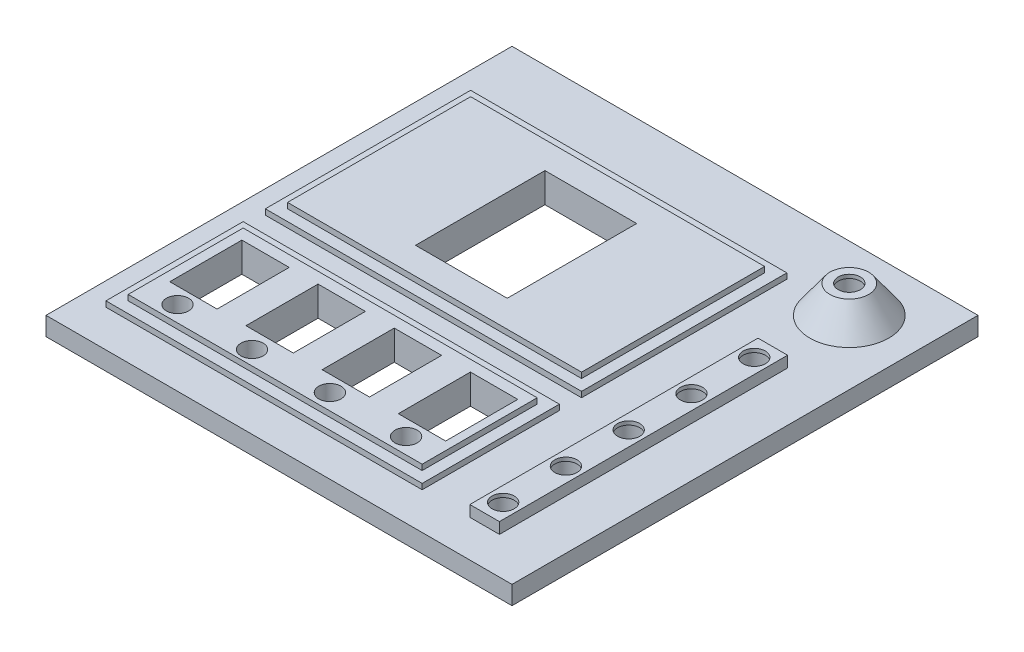
from build123d import *

# Parameters (mm, degrees)
SKETCH1_W           = 126
SKETCH1_H           = 126
BOSS_EXTRUDE1_DEPTH = 5
SKETCH3_R           = 12.5
BOSS_EXTRUDE2_DEPTH = 7.5
SKETCH4_R           = 3.45
CUT_EXTRUDE1_DEPTH  = 11.5
SKETCH6_R           = 3
CUT_EXTRUDE2_DEPTH  = 179.628805068
CHAMFER1_SIZE       = 10
CHAMFER1_SIZE_2     = 7.26542528
SKETCH7_W           = 8
SKETCH7_H           = 77.91635632
BOSS_EXTRUDE3_DEPTH = 3
SKETCH8_R           = 3
CUT_EXTRUDE3_DEPTH  = 179.370401132
SKETCH9_R           = 3.45
CUT_EXTRUDE4_DEPTH  = 7
SKETCH10_W          = 85.5
SKETCH10_H          = 55.5
SKETCH10_H_2        = 37.1
SKETCH10_W_2        = 73.5
SKETCH10_H_3        = 19.1
SKETCH10_W_3        = 36.75
SKETCH10_H_4        = 9.55
BOSS_EXTRUDE5_DEPTH = 1.5
SKETCH12_W          = 79.5
SKETCH12_H          = 49.5
BOSS_EXTRUDE6_DEPTH = 1.5
SKETCH13_W          = 79.5
SKETCH13_H          = 31.1
BOSS_EXTRUDE7_DEPTH = 1.5
SKETCH14_W          = 24.8
SKETCH14_H          = 35
CUT_EXTRUDE5_DEPTH  = 179.370401132
SKETCH15_W          = 12.8
SKETCH15_H          = 19.5
CUT_EXTRUDE6_DEPTH  = 179.370401132
SKETCH16_R          = 3
CUT_EXTRUDE7_DEPTH  = 179.370401132


with BuildPart() as part:
    # Sketch1 → Boss-Extrude1 (new body)
    with BuildSketch(Plane(origin=(0, 0, 0), x_dir=(1, 0, 0), z_dir=(0, 1, 0))):
        with Locations((63, 63)):
            Rectangle(SKETCH1_W, SKETCH1_H)
    extrude(amount=BOSS_EXTRUDE1_DEPTH)

    # Sketch3 → Boss-Extrude2 (add)
    with BuildSketch(Plane(origin=(0, 5, 0), x_dir=(1, 0, 0), z_dir=(0, 1, 0))):
        with Locations(Location((108.6, 108.6, 0), (0, 0, 90))):
            Circle(SKETCH3_R)
    extrude(amount=BOSS_EXTRUDE2_DEPTH)

    # Sketch4 → Cut-Extrude1 (cut)
    with BuildSketch(Plane.XZ):
        with Locations(Location((108.6, -108.6, 0), (0, 0, 270))):
            Circle(SKETCH4_R)
    extrude(amount=-CUT_EXTRUDE1_DEPTH, mode=Mode.SUBTRACT)

    # Sketch6 → Cut-Extrude2 (cut, through all)
    with BuildSketch(Plane(origin=(0, 12.5, 0), x_dir=(1, 0, 0), z_dir=(0, 1, 0))):
        with Locations(Location((108.6, 108.6, 0), (0, 0, 270))):
            Circle(SKETCH6_R)
    extrude(amount=-CUT_EXTRUDE2_DEPTH, mode=Mode.SUBTRACT)

    # Chamfer1
    # the kernel refuses this chamfer: 10, 7.26542528 mm, written as the material it takes off along each edge
    with BuildSketch(Plane(origin=(108.6, 12.5, -108.6), x_dir=(0, 0, -1), z_dir=(1, 0, 0))) as chamfer1_piece_1_section:
        Polygon((12.5, -CHAMFER1_SIZE), (12.5 - CHAMFER1_SIZE_2, 0), (12.5, 0), align=None)
    chamfer1_piece_1 = revolve(axis=Axis((108.6, 12.5, -108.6), (0, 1, 0)), mode=Mode.PRIVATE)
    chamfer1_piece_1 = split(chamfer1_piece_1, bisect_by=Plane(origin=(108.6, 5, -100.650989912), z_dir=(0, 1, 0)), keep=Keep.TOP, mode=Mode.PRIVATE)
    add(chamfer1_piece_1, mode=Mode.SUBTRACT)

    # Sketch7 → Boss-Extrude3 (add)
    with BuildSketch(Plane(origin=(0, 5, 0), x_dir=(1, 0, 0), z_dir=(0, 1, 0))):
        with Locations((108.6, 48.95817816)):
            Rectangle(SKETCH7_W, SKETCH7_H)
    extrude(amount=BOSS_EXTRUDE3_DEPTH)

    # Sketch8 → Cut-Extrude3 (cut, through all)
    with BuildSketch(Plane(origin=(0, 8, 0), x_dir=(1, 0, 0), z_dir=(0, 1, 0))):
        with Locations(Location((108.6, 15, 0), (0, 0, 270))):
            Circle(SKETCH8_R)
        with Locations(Location((108.6, 31.974801407, 0), (0, 0, 270))):
            Circle(SKETCH8_R)
        with Locations(Location((108.6, 48.949602814, 0), (0, 0, 270))):
            Circle(SKETCH8_R)
        with Locations(Location((108.6, 65.924404221, 0), (0, 0, 270))):
            Circle(SKETCH8_R)
        with Locations(Location((108.6, 82.899205628, 0), (0, 0, 270))):
            Circle(SKETCH8_R)
    extrude(amount=-CUT_EXTRUDE3_DEPTH, mode=Mode.SUBTRACT)

    # Sketch9 → Cut-Extrude4 (cut)
    with BuildSketch(Plane.XZ):
        with Locations(Location((108.6, -82.899205628, 0), (0, 0, 270))):
            Circle(SKETCH9_R)
        with Locations(Location((108.6, -65.924404221, 0), (0, 0, 270))):
            Circle(SKETCH9_R)
        with Locations(Location((108.6, -48.949602814, 0), (0, 0, 270))):
            Circle(SKETCH9_R)
        with Locations(Location((108.6, -15, 0), (0, 0, 270))):
            Circle(SKETCH9_R)
        with Locations(Location((108.6, -31.974801407, 0), (0, 0, 270))):
            Circle(SKETCH9_R)
    extrude(amount=-CUT_EXTRUDE4_DEPTH, mode=Mode.SUBTRACT)

    # Sketch10 → Boss-Extrude5 (add)
    # profile 1 of 6: a face of its own
    with BuildSketch(Plane(origin=(0, 5, 0), x_dir=(1, 0, 0), z_dir=(0, 1, 0))):
        with Locations((48.95817816, 80.85)):
            Rectangle(SKETCH10_W, SKETCH10_H)
    # profile 2 of 6: a face of its own
    with BuildSketch(Plane(origin=(0, 5, 0), x_dir=(1, 0, 0), z_dir=(0, 1, 0))):
        with Locations((48.95817816, 28.55)):
            Rectangle(SKETCH10_W, SKETCH10_H_2)
        with Locations((48.95817816, 31.55)):
            Rectangle(SKETCH10_W_2, SKETCH10_H_3, mode=Mode.SUBTRACT)
    # profile 3 of 6: a face of its own
    with BuildSketch(Plane(origin=(0, 5, 0), x_dir=(1, 0, 0), z_dir=(0, 1, 0))):
        with Locations((30.58317816, 26.775)):
            Rectangle(SKETCH10_W_3, SKETCH10_H_4)
    # profile 4 of 6: a face of its own
    with BuildSketch(Plane(origin=(0, 5, 0), x_dir=(1, 0, 0), z_dir=(0, 1, 0))):
        with Locations((30.58317816, 36.325)):
            Rectangle(SKETCH10_W_3, SKETCH10_H_4)
    # profile 5 of 6: a face of its own
    with BuildSketch(Plane(origin=(0, 5, 0), x_dir=(1, 0, 0), z_dir=(0, 1, 0))):
        with Locations((67.33317816, 36.325)):
            Rectangle(SKETCH10_W_3, SKETCH10_H_4)
    # profile 6 of 6: a face of its own
    with BuildSketch(Plane(origin=(0, 5, 0), x_dir=(1, 0, 0), z_dir=(0, 1, 0))):
        with Locations((67.33317816, 26.775)):
            Rectangle(SKETCH10_W_3, SKETCH10_H_4)
    extrude(amount=BOSS_EXTRUDE5_DEPTH)

    # Sketch12 → Boss-Extrude6 (add)
    with BuildSketch(Plane(origin=(0, 6.5, 0), x_dir=(1, 0, 0), z_dir=(0, 1, 0))):
        with Locations((48.95817816, 80.85)):
            Rectangle(SKETCH12_W, SKETCH12_H)
    extrude(amount=BOSS_EXTRUDE6_DEPTH)

    # Sketch13 → Boss-Extrude7 (add)
    with BuildSketch(Plane(origin=(0, 6.5, 0), x_dir=(1, 0, 0), z_dir=(0, 1, 0))):
        with Locations((48.95817816, 28.55)):
            Rectangle(SKETCH13_W, SKETCH13_H)
    extrude(amount=BOSS_EXTRUDE7_DEPTH)

    # Sketch14 → Cut-Extrude5 (cut, through all)
    with BuildSketch(Plane(origin=(0, 8, 0), x_dir=(1, 0, 0), z_dir=(0, 1, 0))):
        with Locations((48.95817816, 80.85)):
            Rectangle(SKETCH14_W, SKETCH14_H)
    extrude(amount=-CUT_EXTRUDE5_DEPTH, mode=Mode.SUBTRACT)

    # Sketch15 → Cut-Extrude6 (cut, through all)
    with BuildSketch(Plane(origin=(0, 8, 0), x_dir=(1, 0, 0), z_dir=(0, 1, 0))):
        with Locations((38.862130436, 31.35)):
            Rectangle(SKETCH15_W, SKETCH15_H)
        with Locations((18.262130436, 31.35)):
            Rectangle(SKETCH15_W, SKETCH15_H)
        with Locations((59.462130436, 31.35)):
            Rectangle(SKETCH15_W, SKETCH15_H)
        with Locations((80.062130436, 31.35)):
            Rectangle(SKETCH15_W, SKETCH15_H)
    extrude(amount=-CUT_EXTRUDE6_DEPTH, mode=Mode.SUBTRACT)

    # Sketch16 → Cut-Extrude7 (cut, through all)
    with BuildSketch(Plane(origin=(0, 8, 0), x_dir=(1, 0, 0), z_dir=(0, 1, 0))):
        with Locations(Location((18.262130436, 17.3, 0), (0, 0, 270))):
            Circle(SKETCH16_R)
        with Locations(Location((38.862130436, 16.84840868, 0), (0, 0, 270))):
            Circle(SKETCH16_R)
        with Locations(Location((59.462130436, 17.3, 0), (0, 0, 270))):
            Circle(SKETCH16_R)
        with Locations(Location((80.062130436, 17.3, 0), (0, 0, 270))):
            Circle(SKETCH16_R)
    extrude(amount=-CUT_EXTRUDE7_DEPTH, mode=Mode.SUBTRACT)


solid = part.part
